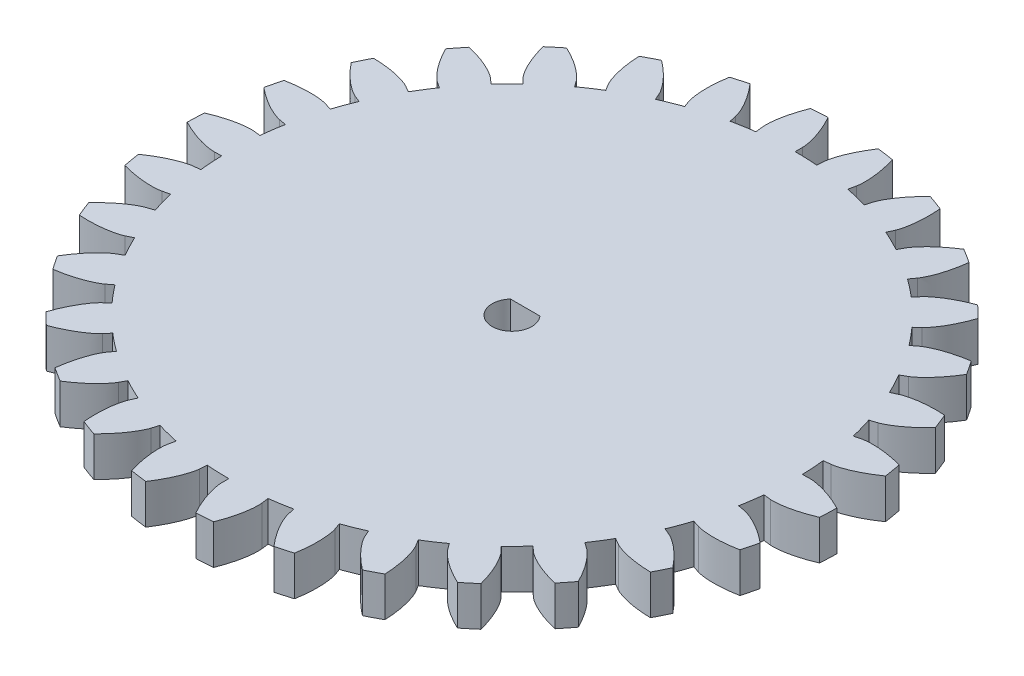
from build123d import *

# Parameters (mm, degrees)
GEAR_BILLET_R             = 24.96
GEAR_BILLET_EXTRUDE_DEPTH = 3
CUT_TOOTH_PROFILE_REACH   = 37.426
DUPLICATE_TEETH_COUNT     = 30
CUT_EXTRUDE1_DEPTH        = 36.41032234


with BuildPart() as part:
    # Gear billet → Gear billet Extrude (new body)
    with BuildSketch(Plane(origin=(0, 0, 0), x_dir=(1, 0, 0), z_dir=(0, 1, 0))):
        Circle(GEAR_BILLET_R)
    extrude(amount=GEAR_BILLET_EXTRUDE_DEPTH)

    # Tooth profile → Cut tooth profile (cut, up to next)
    with BuildSketch(Plane(origin=(0, 3, 0), x_dir=(1, 0, 0), z_dir=(0, 1, 0)), mode=Mode.PRIVATE) as cut_tooth_profile_sk1:
        with BuildLine():
            Line((0, 21.988807326), (0, 21.45))
            ThreePointArc((0, 21.45), (0.848990375, 21.433191907), (1.696650222, 21.382793971))
            Line((1.696650222, 21.382793971), (1.739268757, 21.919913135))
            add(Edge.make_bspline(
                [(1.739268757, 21.919913135), (1.741950544, 21.953711555), (1.749331215, 22.021073566), (1.780575487, 22.208729299), (1.867166111, 22.560964541), (2.04601574, 23.087806513), (2.341115229, 23.742388429), (2.630967732, 24.262304255), (2.855179999, 24.620366529), (2.962478695, 24.783569557)],
                knots=[0, 0, 0, 0, 0, 0.002802036, 0.005604071, 0.015718253, 0.029959921, 0.048733673, 0.064883743, 0.064883743, 0.064883743, 0.064883743, 0.064883743], degree=4))
            ThreePointArc((2.962478695, 24.783569557), (0.987916072, 24.940441492), (-0.992868196, 24.940244841))
            add(Edge.make_bspline(
                [(0, 21.988807326), (0, 22.022711975), (-0.002029352, 22.090446727), (-0.018332554, 22.279985863), (-0.076790805, 22.637966638), (-0.213407971, 23.177304568), (-0.455806807, 23.853177335), (-0.703626902, 24.394390915), (-0.898814701, 24.76906605), (-0.992868196, 24.940244841)],
                knots=[0, 0, 0, 0, 0, 0.002802036, 0.005604071, 0.015718253, 0.029959921, 0.048733673, 0.064883743, 0.064883743, 0.064883743, 0.064883743, 0.064883743], degree=4))
        make_face()
    cut_tooth_profile_tool1 = extrude(cut_tooth_profile_sk1.sketch, amount=-CUT_TOOTH_PROFILE_REACH, mode=Mode.PRIVATE) & part.part
    cut_tooth_profile = cut_tooth_profile_tool1.solids().sort_by_distance((0.928804, 3, -23.448139))[0]
    add(cut_tooth_profile, mode=Mode.SUBTRACT)

    # Duplicate teeth: Cut tooth profile ×30 about axis
    duplicate_teeth_axis = Axis((0, 3, 0), (0, -1, 0))
    for i in range(1, DUPLICATE_TEETH_COUNT):
        add(cut_tooth_profile.rotate(duplicate_teeth_axis, i * 360 / DUPLICATE_TEETH_COUNT), mode=Mode.SUBTRACT)

    # Sketch1 → Cut-Extrude1 (cut, through all)
    with BuildSketch(Plane(origin=(0, 3, 0), x_dir=(1, 0, 0), z_dir=(0, 1, 0))):
        with BuildLine():
            Line((-1.118033989, 1), (1.118033989, 1))
            ThreePointArc((1.118033989, 1), (0, -1.5), (-1.118033989, 1))
        make_face()
    extrude(amount=-CUT_EXTRUDE1_DEPTH, mode=Mode.SUBTRACT)


solid = part.part
